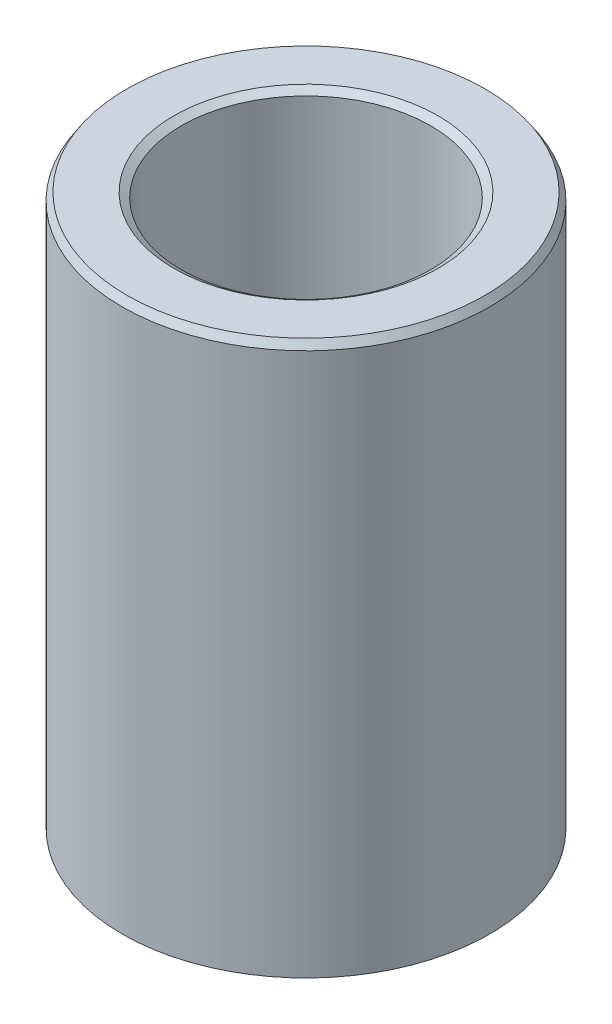
from build123d import *
from OCP.BRepFilletAPI import BRepFilletAPI_MakeChamfer

# Parameters (mm, degrees)
SKETCH1_R           = 10
BOSS_EXTRUDE1_DEPTH = 30.21889988
SKETCH2_R           = 6.783202268
CUT_EXTRUDE1_DEPTH  = 34.364380857
CHAMFER1_SIZE       = 0.407448466
CHAMFER1_SIZE2      = 0.264981801


with BuildPart() as part:
    # Sketch1 → Boss-Extrude1 (new body)
    with BuildSketch(Plane(origin=(0, 0, 0), x_dir=(1, 0, 0), z_dir=(0, 1, 0))):
        Circle(SKETCH1_R)
    extrude(amount=BOSS_EXTRUDE1_DEPTH)

    # Sketch2 → Cut-Extrude1 (cut, through all)
    with BuildSketch(Plane(origin=(0, 0, 0), x_dir=(1, 0, 0), z_dir=(0, 1, 0))):
        Circle(SKETCH2_R)
    extrude(amount=CUT_EXTRUDE1_DEPTH, mode=Mode.SUBTRACT)

    # Chamfer1: one chamfer whose edges measure the first distance from different faces: ONE call of the kernel's chamfer builder (chamfer() names one face for all edges)
    chamfer1_edges_1 = [part.edges().sort_by_distance(p)[0] for p in [
        (-6.783202268, 30.21889988, 0),
    ]]
    chamfer1_side_1 = [part.faces().sort_by_distance(p)[0] for p in [
        (-9.717157288, 30.21889988, 0),
    ]]
    chamfer1_edges_2 = [part.edges().sort_by_distance(p)[0] for p in [
        (-6.783202268, 0, 0),
    ]]
    chamfer1_side_2 = [part.faces().sort_by_distance(p)[0] for p in [
        (-6.783202268, 15.10944994, 0),
    ]]
    chamfer1_edges_3 = [part.edges().sort_by_distance(p)[0] for p in [
        (-10, 0, 0),
    ]]
    chamfer1_side_3 = [part.faces().sort_by_distance(p)[0] for p in [
        (-9.717157288, 0, 0),
    ]]
    chamfer1_edges_4 = [part.edges().sort_by_distance(p)[0] for p in [
        (-10, 30.21889988, 0),
    ]]
    chamfer1_side_4 = [part.faces().sort_by_distance(p)[0] for p in [
        (-10, 15.10944994, 0),
    ]]
    chamfer1 = BRepFilletAPI_MakeChamfer(part.part.solid().wrapped)
    for e in chamfer1_edges_1:
        chamfer1.Add(CHAMFER1_SIZE, CHAMFER1_SIZE2, e.wrapped, chamfer1_side_1[0].wrapped)  # the first distance lies on this face
    for e in chamfer1_edges_2:
        chamfer1.Add(CHAMFER1_SIZE, CHAMFER1_SIZE2, e.wrapped, chamfer1_side_2[0].wrapped)  # the first distance lies on this face
    for e in chamfer1_edges_3:
        chamfer1.Add(CHAMFER1_SIZE, CHAMFER1_SIZE2, e.wrapped, chamfer1_side_3[0].wrapped)  # the first distance lies on this face
    for e in chamfer1_edges_4:
        chamfer1.Add(CHAMFER1_SIZE, CHAMFER1_SIZE2, e.wrapped, chamfer1_side_4[0].wrapped)  # the first distance lies on this face
    add(Compound.cast(chamfer1.Shape()), mode=Mode.REPLACE)


solid = part.part
